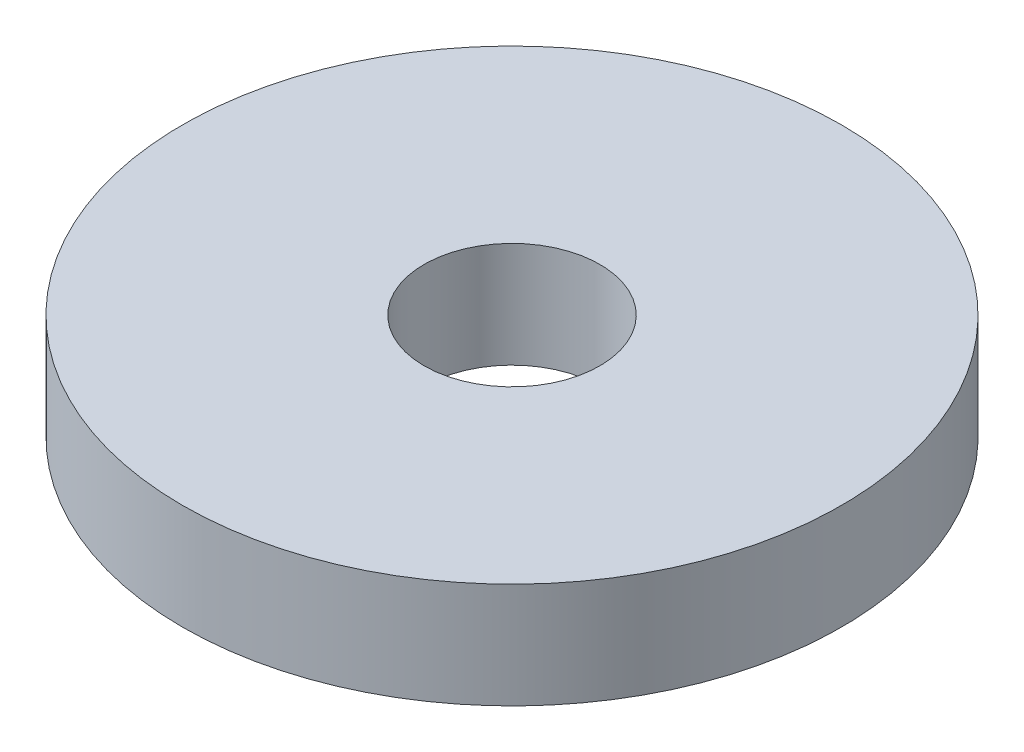
from build123d import *

# Parameters (mm, degrees)
SKETCH1_R           = 37.5
BOSS_EXTRUDE1_DEPTH = 12
SKETCH2_R           = 10
CUT_EXTRUDE1_DEPTH  = 55.373706881


with BuildPart() as part:
    # Sketch1 → Boss-Extrude1 (new body)
    with BuildSketch(Plane(origin=(0, 0, 0), x_dir=(1, 0, 0), z_dir=(0, 1, 0))):
        Circle(SKETCH1_R)
    extrude(amount=BOSS_EXTRUDE1_DEPTH)

    # Sketch2 → Cut-Extrude1 (cut, through all)
    with BuildSketch(Plane(origin=(0, 0, 0), x_dir=(1, 0, 0), z_dir=(0, 1, 0))):
        Circle(SKETCH2_R)
    extrude(amount=CUT_EXTRUDE1_DEPTH, mode=Mode.SUBTRACT)


solid = part.part
